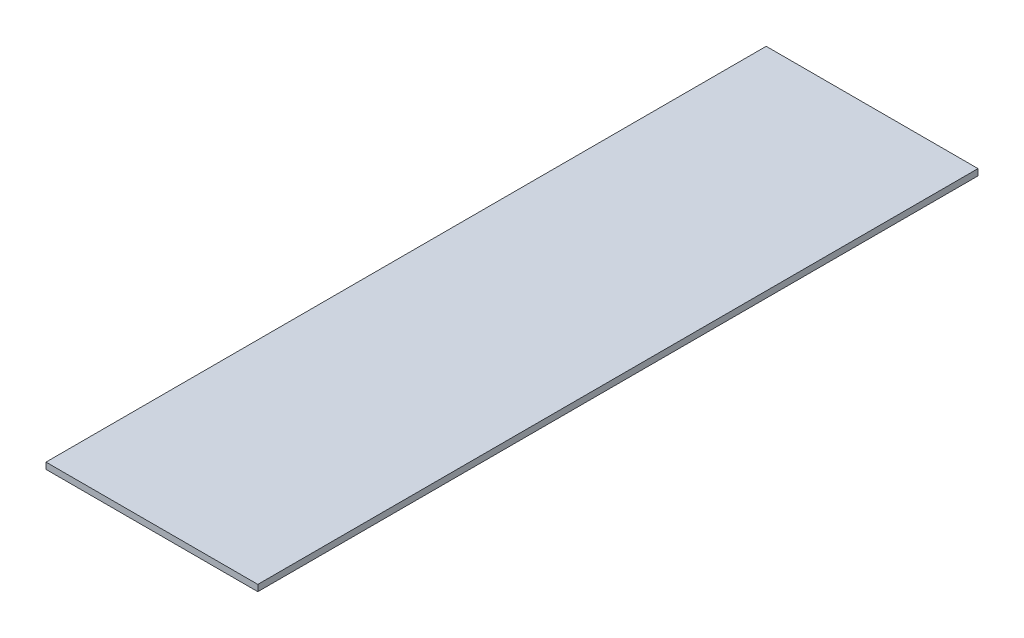
from build123d import *

# Parameters (mm, degrees)
SKETCH1_W           = 63.5
SKETCH1_H           = 215.9
BOSS_EXTRUDE1_DEPTH = 1.905


with BuildPart() as part:
    # Sketch1 → Boss-Extrude1 (new body)
    with BuildSketch(Plane(origin=(0, 0, 0), x_dir=(1, 0, 0), z_dir=(0, 1, 0))):
        with Locations((31.75, 107.95)):
            Rectangle(SKETCH1_W, SKETCH1_H)
    extrude(amount=BOSS_EXTRUDE1_DEPTH)


solid = part.part
